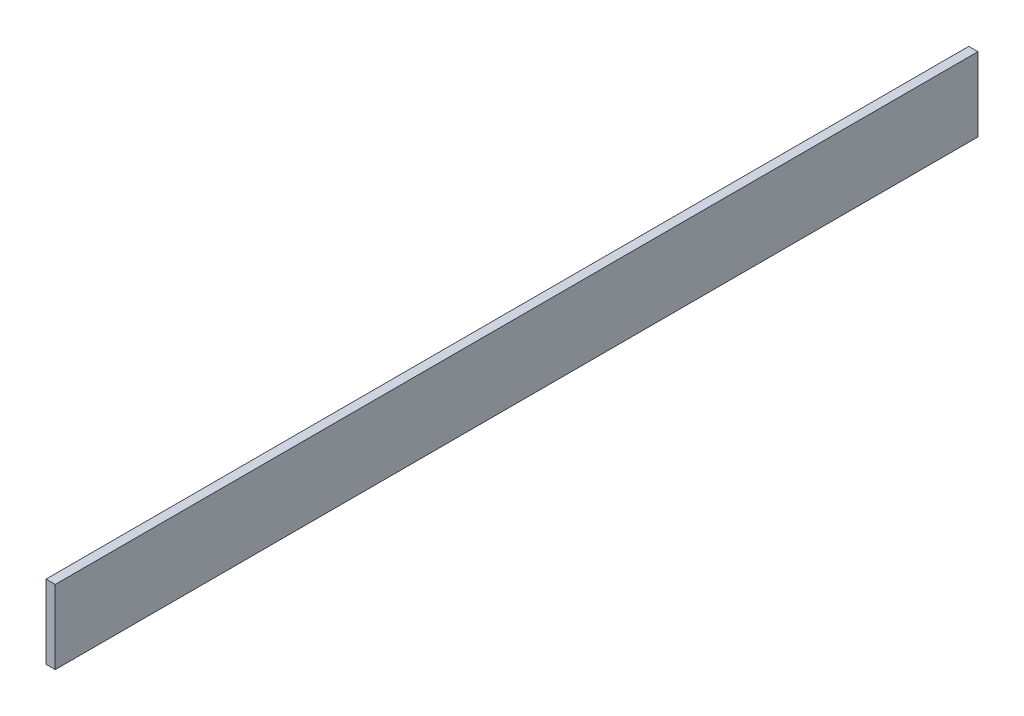
from build123d import *

# Parameters (mm, degrees)
SKETCH1_W           = 1270
SKETCH1_H           = 101.6
BOSS_EXTRUDE1_DEPTH = 12.7


with BuildPart() as part:
    # Sketch1 → Boss-Extrude1 (new body)
    with BuildSketch(Plane(origin=(0, 0, 0), x_dir=(0, 0, -1), z_dir=(1, 0, 0))):
        Rectangle(SKETCH1_W, SKETCH1_H)
    extrude(amount=BOSS_EXTRUDE1_DEPTH)


solid = part.part
